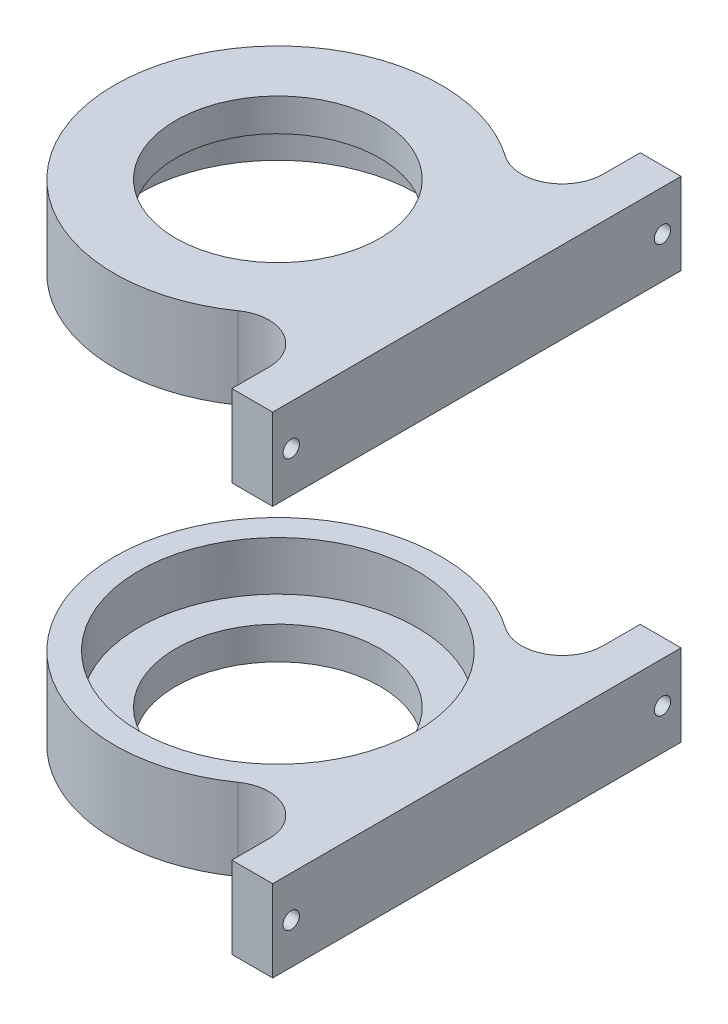
from build123d import *

# Parameters (mm, degrees)
SKETCH_1_W                                = 300
SKETCH_1_H                                = 120
EXTRUDE_1_DEPTH                           = 100
EXTRUDE_2_DEPTH                           = 20
FILLET_2_R                                = 10
FILLET_3_R                                = 10
MIRROR_6_AT_THE_SECOND_PLANE_COPY_1_DEPTH = 20
FILLET_10_R                               = 10
FILLET_11_R                               = 10
FILLET_12_R                               = 10
FILLET_13_R                               = 10
FILLET_14_R                               = 10
FILLET_15_R                               = 10
CUT_EXTRUDE_1_REACH                       = 258.744
PATTERN_LINEAR_1_COUNT                    = 4
PATTERN_LINEAR_1_PITCH                    = 40
PATTERN_LINEAR_1_COL_COUNT                = 4
PATTERN_LINEAR_1_COL_PITCH                = 40
SKETCH_4_R                                = 30
EXTRUDE_3_DEPTH                           = 14
SKETCH_6_R                                = 34
CUT_EXTRUDE_2_DEPTH                       = 284.325496056
FILLET_16_R                               = 5
CUT_EXTRUDE_3_REACH                       = 276.433
SKETCH_7_R                                = 2
PATTERN_CIRCULAR_1_COUNT                  = 6
SKETCH_8_W                                = 104.728180427
SKETCH_8_H                                = 147.280084006
CUT_EXTRUDE_4_DEPTH                       = 399.638039773
SKETCH_9_W                                = 100
SKETCH_9_H                                = 20
EXTRUDE_4_DEPTH                           = 10
SKETCH_10_W                               = 100
SKETCH_10_H                               = 20
EXTRUDE_5_DEPTH                           = 10
SKETCH_11_R                               = 2
CUT_EXTRUDE_5_DEPTH                       = 141.706739984
MIRROR_START                              = -150
MIRROR_8_OUTLINE_R                        = 2
MIRROR_8_DEPTH                            = 10
SKETCH_12_R                               = 2
CUT_EXTRUDE_6_DEPTH                       = 141.706739984
SKETCH_14_R                               = 34
SKETCH_14_R_2                             = 25
EXTRUDE_6_DEPTH                           = 8
SKETCH_15_R                               = 34
SKETCH_15_R_2                             = 25
EXTRUDE_7_DEPTH                           = 8


# Read off the part's stored shape, not the designer's step: 镜向8
with BuildPart() as part:
    # 草图1 → 凸台-拉伸1 (new body)
    with BuildSketch(Plane.XY):
        Rectangle(SKETCH_1_W, SKETCH_1_H)
    extrude(amount=EXTRUDE_1_DEPTH)

    # 草图2 → 凸台-拉伸2 (add)
    with BuildSketch(Plane(origin=(0, 60, 0), x_dir=(1, 0, 0), z_dir=(0, 1, 0))):
        with BuildLine():
            Line((150, -50), (150, -40))
            ThreePointArc((150, -40), (228.729833462, -50), (150, -60))
            Line((150, -60), (150, -50))
        make_face()
    extrude_2 = extrude(amount=-EXTRUDE_2_DEPTH)

    # 圆角2
    fillet_2_edges = [part.edges().sort_by_distance(p)[0] for p in [
        (150, 50, 40),
    ]]
    fillet(fillet_2_edges, radius=FILLET_2_R)

    # 圆角3
    fillet_3_edges = [part.edges().sort_by_distance(p)[0] for p in [
        (150, 50, 60),
    ]]
    fillet(fillet_3_edges, radius=FILLET_3_R)

    # 镜向6: 凸台-拉伸2 across plane
    add(extrude_2.mirror(Plane(origin=(0, 0, 0), x_dir=(0, 0, 1), z_dir=(1, 0, 0))))

    # 镜向6 at the second plane: 凸台-拉伸2 across plane
    add(extrude_2.mirror(Plane.ZX))

    # 镜向6 at the second plane copy 1 sket → 镜向6 at the second plane copy 1 (add)
    with BuildSketch(Plane(origin=(0, -60, 0), x_dir=(-1, 0, 0), z_dir=(0, -1, 0))):
        with BuildLine():
            Line((150, -50), (150, -40))
            ThreePointArc((150, -40), (228.729833462, -50), (150, -60))
            Line((150, -60), (150, -50))
        make_face()
    extrude(amount=-MIRROR_6_AT_THE_SECOND_PLANE_COPY_1_DEPTH)

    # 圆角10
    fillet_10_edges = [part.edges().sort_by_distance(p)[0] for p in [
        (150, -50, 60),
    ]]
    fillet(fillet_10_edges, radius=FILLET_10_R)

    # 圆角11
    fillet_11_edges = [part.edges().sort_by_distance(p)[0] for p in [
        (150, -50, 40),
    ]]
    fillet(fillet_11_edges, radius=FILLET_11_R)

    # 圆角12
    fillet_12_edges = [part.edges().sort_by_distance(p)[0] for p in [
        (-150, 50, 40),
    ]]
    fillet(fillet_12_edges, radius=FILLET_12_R)

    # 圆角13
    fillet_13_edges = [part.edges().sort_by_distance(p)[0] for p in [
        (-150, -50, 60),
    ]]
    fillet(fillet_13_edges, radius=FILLET_13_R)

    # 圆角14
    fillet_14_edges = [part.edges().sort_by_distance(p)[0] for p in [
        (-150, 50, 60),
    ]]
    fillet(fillet_14_edges, radius=FILLET_14_R)

    # 圆角15
    fillet_15_edges = [part.edges().sort_by_distance(p)[0] for p in [
        (-150, -50, 40),
    ]]
    fillet(fillet_15_edges, radius=FILLET_15_R)

    # 草图3 → 切除-拉伸1 (cut, up to next)
    with BuildSketch(Plane.XY.offset(100), mode=Mode.PRIVATE) as cut_extrude_1_sk1:
        with BuildLine():
            Line((-11.916195323, -32.511613), (-11.916195323, 32.511613))
            ThreePointArc((-11.916195323, 32.511613), (0, 44.427808323), (11.916195323, 32.511613))
            Line((11.916195323, 32.511613), (11.916195323, -32.511613))
            ThreePointArc((11.916195323, -32.511613), (0, -44.427808323), (-11.916195323, -32.511613))
        make_face()
    cut_extrude_1_tool1 = extrude(cut_extrude_1_sk1.sketch, amount=-CUT_EXTRUDE_1_REACH, mode=Mode.PRIVATE) & part.part
    cut_extrude_1 = cut_extrude_1_tool1.solids().sort_by_distance((0, 0, 100))[0]
    add(cut_extrude_1, mode=Mode.SUBTRACT)

    # 阵列(线性)1: 切除-拉伸1 ×4
    with Locations(*[(i * PATTERN_LINEAR_1_PITCH, 0, 0) for i in range(1, PATTERN_LINEAR_1_COUNT)]):
        add(cut_extrude_1, mode=Mode.SUBTRACT)

    # 阵列(线性)1 col: 切除-拉伸1 ×4
    with Locations(*[(-i * PATTERN_LINEAR_1_COL_PITCH, 0, 0) for i in range(1, PATTERN_LINEAR_1_COL_COUNT)]):
        add(cut_extrude_1, mode=Mode.SUBTRACT)

    # 草图4 → 凸台-拉伸3 (add)
    with BuildSketch(Plane.XZ.offset(60)):
        with Locations(Location((188.729833462, 50, 0), (0, 0, 90))):
            Circle(SKETCH_4_R)
    extrude(amount=EXTRUDE_3_DEPTH)

    # 草图6 → 切除-拉伸2 (cut, through all)
    with BuildSketch(Plane(origin=(0, 60, 0), x_dir=(1, 0, 0), z_dir=(0, 1, 0))):
        with Locations(Location((-188.729833462, -50, 0), (0, 0, 270))):
            Circle(SKETCH_6_R)
    extrude(amount=-CUT_EXTRUDE_2_DEPTH, mode=Mode.SUBTRACT)

    # 圆角16
    fillet_16_edges = [part.edges().sort_by_distance(p)[0] for p in [
        (-150, 0, 100),
        (0, -60, 100),
        (150, 0, 100),
        (0, -60, 0),
        (-150, 0, 0),
        (0, 60, 0),
        (150, 0, 0),
        (0, 60, 100),
    ]]
    fillet(fillet_16_edges, radius=FILLET_16_R)

    # 草图7 → 切除-拉伸3 (cut, up to next)
    with BuildSketch(Plane.XZ.offset(-40), mode=Mode.PRIVATE) as cut_extrude_3_sk1:
        with Locations(Location((188.729833462, 84.5, 0), (0, 0, 270))):
            Circle(SKETCH_7_R)
    cut_extrude_3_tool1 = extrude(cut_extrude_3_sk1.sketch, amount=-CUT_EXTRUDE_3_REACH, mode=Mode.PRIVATE) & part.part
    cut_extrude_3 = cut_extrude_3_tool1.solids().sort_by_distance((188.729833, 40, 84.5))[0]
    add(cut_extrude_3, mode=Mode.SUBTRACT)

    # 阵列(圆周)1: 切除-拉伸3 ×6 about axis
    pattern_circular_1_axis = Axis((188.729833462, 0, 50), (0, 1, 0))
    for i in range(1, PATTERN_CIRCULAR_1_COUNT):
        add(cut_extrude_3.rotate(pattern_circular_1_axis, i * 360 / PATTERN_CIRCULAR_1_COUNT), mode=Mode.SUBTRACT)

    # 草图8 → 切除-拉伸4 (cut, through all)
    with BuildSketch(Plane.ZY.offset(150)):
        with Locations((52.364090214, -7.105652858)):
            Rectangle(SKETCH_8_W, SKETCH_8_H)
    extrude(amount=-CUT_EXTRUDE_4_DEPTH, mode=Mode.SUBTRACT)


with BuildPart() as cut_extrude_4_piece_1:
    # of the separate pieces the step leaves, piece 1, a body of its own (cut_extrude_4_pieces)
    add(part.part.solids().sort_by_distance((-150, -60, 9.078163907))[0])

    # 草图10 → 凸台-拉伸5 (add)
    with BuildSketch(Plane(origin=(-150, 0, 0), x_dir=(0, 0, -1), z_dir=(1, 0, 0))):
        with Locations((-50, -50)):
            Rectangle(SKETCH_10_W, SKETCH_10_H)
    extrude(amount=EXTRUDE_5_DEPTH)

    # 草图11 → 切除-拉伸5 (cut, through all)
    with BuildSketch(Plane.ZY.offset(150)):
        with Locations((95.460918047, -50)):
            Circle(SKETCH_11_R)
    extrude(amount=-CUT_EXTRUDE_5_DEPTH, mode=Mode.SUBTRACT)

    # 镜向8 outline → 镜向8 (cut)
    with BuildSketch(Plane.YZ.offset(MIRROR_START)):
        with Locations((-50, 4.539081953)):
            Circle(MIRROR_8_OUTLINE_R)
    extrude(amount=MIRROR_8_DEPTH, mode=Mode.SUBTRACT)

    # 草图14 → 凸台-拉伸6 (add)
    with BuildSketch(Plane(origin=(0, -60, 0), x_dir=(-1, 0, 0), z_dir=(0, -1, 0))):
        with Locations(Location((188.729833462, -50, 0), (0, 0, 270))):
            Circle(SKETCH_14_R)
        with Locations(Location((188.729833462, -50, 0), (0, 0, 90))):
            Circle(SKETCH_14_R_2, mode=Mode.SUBTRACT)
    extrude(amount=-EXTRUDE_6_DEPTH)


with BuildPart() as cut_extrude_4_piece_2:
    # of the separate pieces the step leaves, piece 2, a body of its own (cut_extrude_4_pieces)
    add(part.part.solids().sort_by_distance((-150, 60, 9.078163907))[0])

    # 草图9 → 凸台-拉伸4 (add)
    with BuildSketch(Plane(origin=(-150, 0, 0), x_dir=(0, 0, -1), z_dir=(1, 0, 0))):
        with Locations((-50, 50)):
            Rectangle(SKETCH_9_W, SKETCH_9_H)
    extrude(amount=EXTRUDE_4_DEPTH)

    # 草图12 → 切除-拉伸6 (cut, through all)
    with BuildSketch(Plane.ZY.offset(150)):
        with Locations((95.460918047, 50)):
            Circle(SKETCH_12_R)
    cut_extrude_6 = extrude(amount=-CUT_EXTRUDE_6_DEPTH, mode=Mode.SUBTRACT)

    # 镜向10: 切除-拉伸6 across plane
    add(cut_extrude_6.mirror(Plane.XY.offset(50)), mode=Mode.SUBTRACT)

    # 草图15 → 凸台-拉伸7 (add)
    with BuildSketch(Plane(origin=(0, 60, 0), x_dir=(1, 0, 0), z_dir=(0, 1, 0))):
        with Locations(Location((-188.729833462, -50, 0), (0, 0, 270))):
            Circle(SKETCH_15_R)
        with Locations(Location((-188.729833462, -50, 0), (0, 0, 270))):
            Circle(SKETCH_15_R_2, mode=Mode.SUBTRACT)
    extrude(amount=-EXTRUDE_7_DEPTH)


solid = Compound([cut_extrude_4_piece_1.part, cut_extrude_4_piece_2.part])
